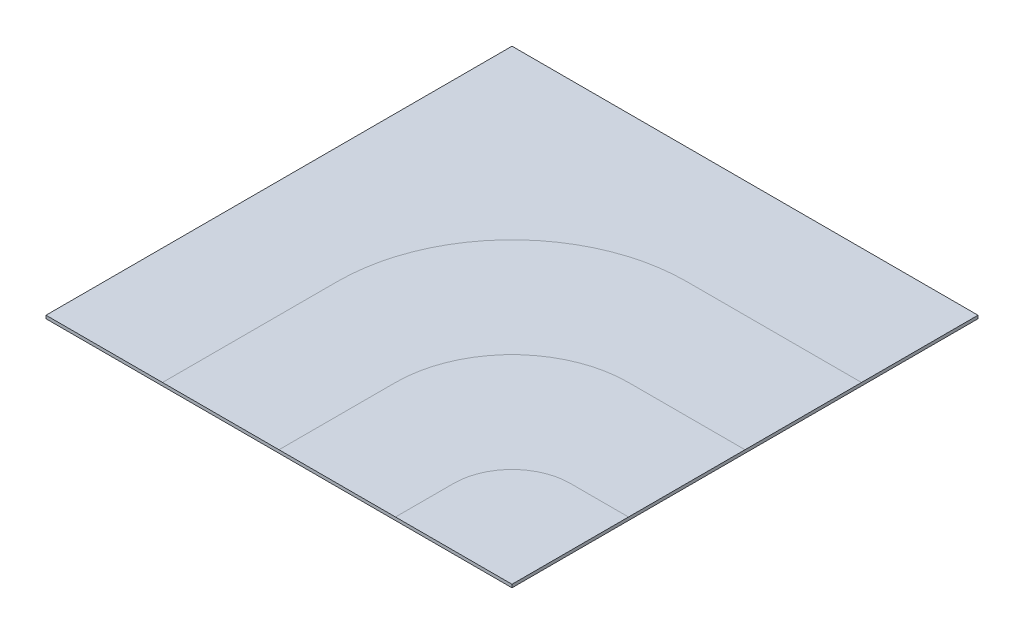
from build123d import *

# Parameters (mm, degrees)
SKETCH2_W           = 1500
SKETCH2_H           = 1500
BOSS_EXTRUDE2_DEPTH = 10


with BuildPart() as part:
    # Sketch2 → Boss-Extrude2 (new body)
    with BuildSketch(Plane(origin=(0, 0, 0), x_dir=(1, 0, 0), z_dir=(0, 1, 0))):
        with Locations((750, 750)):
            Rectangle(SKETCH2_W, SKETCH2_H)
    extrude(amount=BOSS_EXTRUDE2_DEPTH)


solid = part.part
